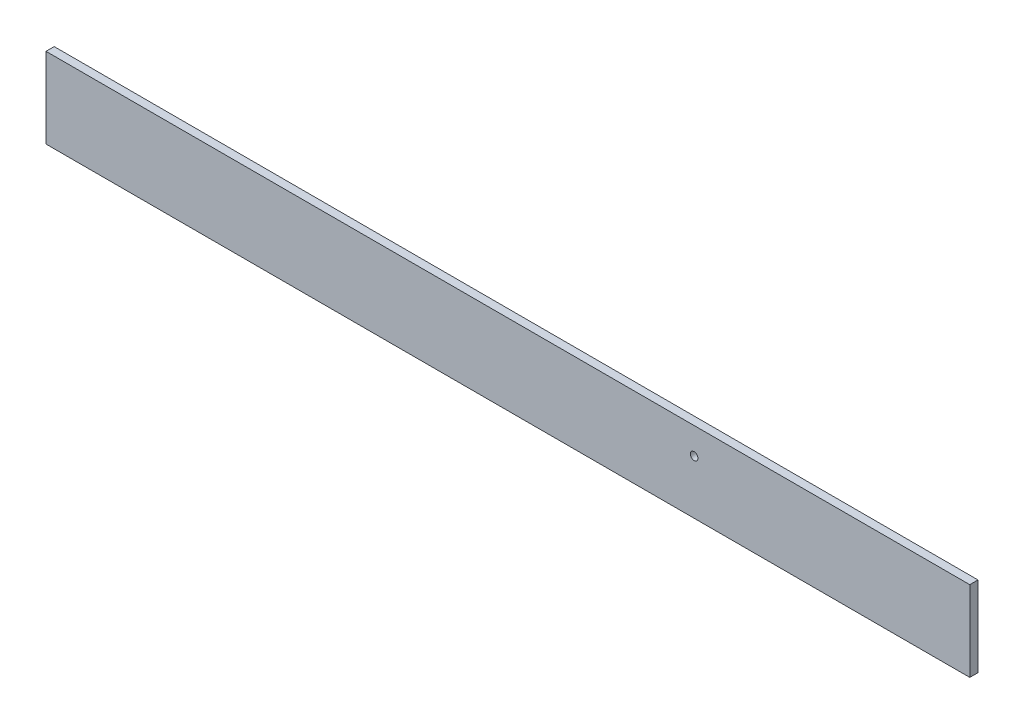
from build123d import *

# Parameters (mm, degrees)
SKETCH2_W           = 506
SKETCH2_H           = 44
SKETCH2_R           = 2.1
BOSS_EXTRUDE1_DEPTH = 4.5


with BuildPart() as part:
    # Sketch2 → Boss-Extrude1 (new body)
    with BuildSketch(Plane.XY):
        Rectangle(SKETCH2_W, SKETCH2_H)
        with Locations((102, 7.5)):
            Circle(SKETCH2_R, mode=Mode.SUBTRACT)
    extrude(amount=BOSS_EXTRUDE1_DEPTH)


solid = part.part
